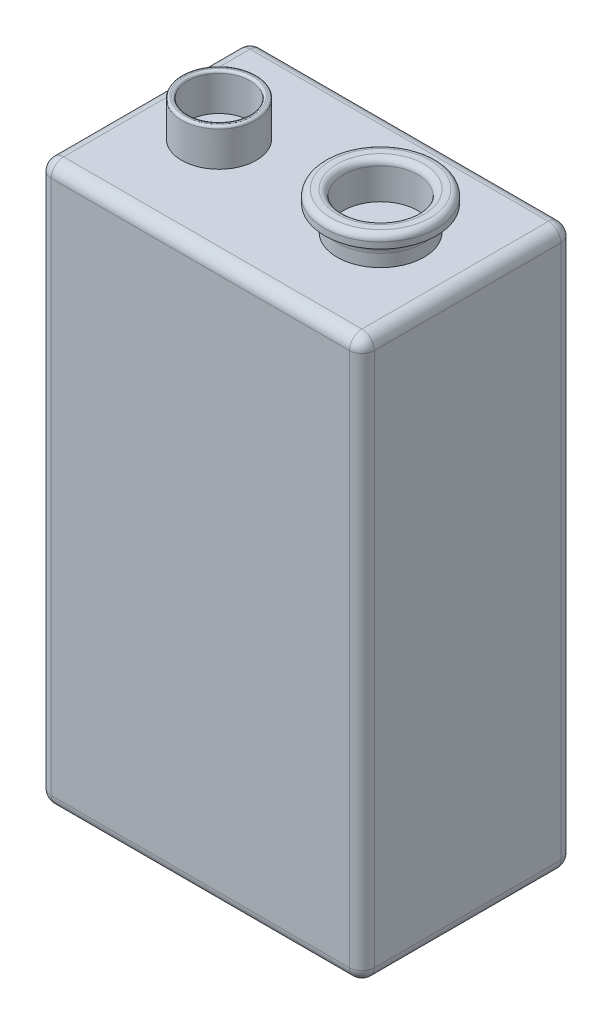
from build123d import *

# Parameters (mm, degrees)
SKETCH1_W           = 26
SKETCH1_H           = 17
BOSS_EXTRUDE1_DEPTH = 45
FILLET1_R           = 1
SKETCH2_R           = 3
SKETCH2_R_2         = 2.5
BOSS_EXTRUDE2_DEPTH = 3
SKETCH3_R           = 3.5
SKETCH3_R_2         = 3
BOSS_EXTRUDE3_DEPTH = 2
SKETCH4_R           = 4.5
SKETCH4_R_2         = 3
BOSS_EXTRUDE4_DEPTH = 1
FILLET4_R           = 1
FILLET5_R           = 0.5
FILLET6_R           = 0.2


with BuildPart() as part:
    # Sketch1 → Boss-Extrude1 (new body)
    with BuildSketch(Plane(origin=(0, 0, 0), x_dir=(1, 0, 0), z_dir=(0, 1, 0))):
        Rectangle(SKETCH1_W, SKETCH1_H)
    extrude(amount=BOSS_EXTRUDE1_DEPTH)

    # Fillet1
    fillet1_edges = [part.edges().sort_by_distance(p)[0] for p in [
        (13, 45, 0),
        (0, 45, -8.5),
        (-13, 45, 0),
        (0, 0, -8.5),
        (13, 0, 0),
        (0, 0, 8.5),
        (-13, 0, 0),
        (0, 45, 8.5),
        (-13, 22.5, -8.5),
        (13, 22.5, -8.5),
        (13, 22.5, 8.5),
        (-13, 22.5, 8.5),
    ]]
    fillet(fillet1_edges, radius=FILLET1_R)

    # Sketch2 → Boss-Extrude2 (add)
    with BuildSketch(Plane(origin=(0, 45, 0), x_dir=(1, 0, 0), z_dir=(0, 1, 0))):
        with Locations(Location((-7, 0, 0), (0, 0, 90))):
            Circle(SKETCH2_R)
        with Locations(Location((-7, 0, 0), (0, 0, 270))):
            Circle(SKETCH2_R_2, mode=Mode.SUBTRACT)
    extrude(amount=BOSS_EXTRUDE2_DEPTH)

    # Sketch3 → Boss-Extrude3 (add)
    with BuildSketch(Plane(origin=(0, 45, 0), x_dir=(1, 0, 0), z_dir=(0, 1, 0))):
        with Locations(Location((6, 0, 0), (0, 0, 90))):
            Circle(SKETCH3_R)
        with Locations(Location((6, 0, 0), (0, 0, 270))):
            Circle(SKETCH3_R_2, mode=Mode.SUBTRACT)
    extrude(amount=BOSS_EXTRUDE3_DEPTH)

    # Sketch4 → Boss-Extrude4 (add)
    with BuildSketch(Plane(origin=(0, 47, 0), x_dir=(1, 0, 0), z_dir=(0, 1, 0))):
        with Locations(Location((6, 0, 0), (0, 0, 270))):
            Circle(SKETCH4_R)
        with Locations(Location((6, 0, 0), (0, 0, 270))):
            Circle(SKETCH4_R_2, mode=Mode.SUBTRACT)
    extrude(amount=BOSS_EXTRUDE4_DEPTH)

    # Fillet4
    fillet4_edges = [part.edges().sort_by_distance(p)[0] for p in [
        (6, 47, 3.5),
    ]]
    fillet(fillet4_edges, radius=FILLET4_R - 0.0001)  # a hair under: the kernel refuses the full size

    # Fillet5
    fillet5_edges = [part.edges().sort_by_distance(p)[0] for p in [
        (6, 48, -4.5),
        (6, 48, -3),
    ]]
    fillet(fillet5_edges, radius=FILLET5_R)

    # Fillet6
    fillet6_edges = [part.edges().sort_by_distance(p)[0] for p in [
        (-7, 48, 3),
        (-7, 48, -2.5),
    ]]
    fillet(fillet6_edges, radius=FILLET6_R)


solid = part.part
